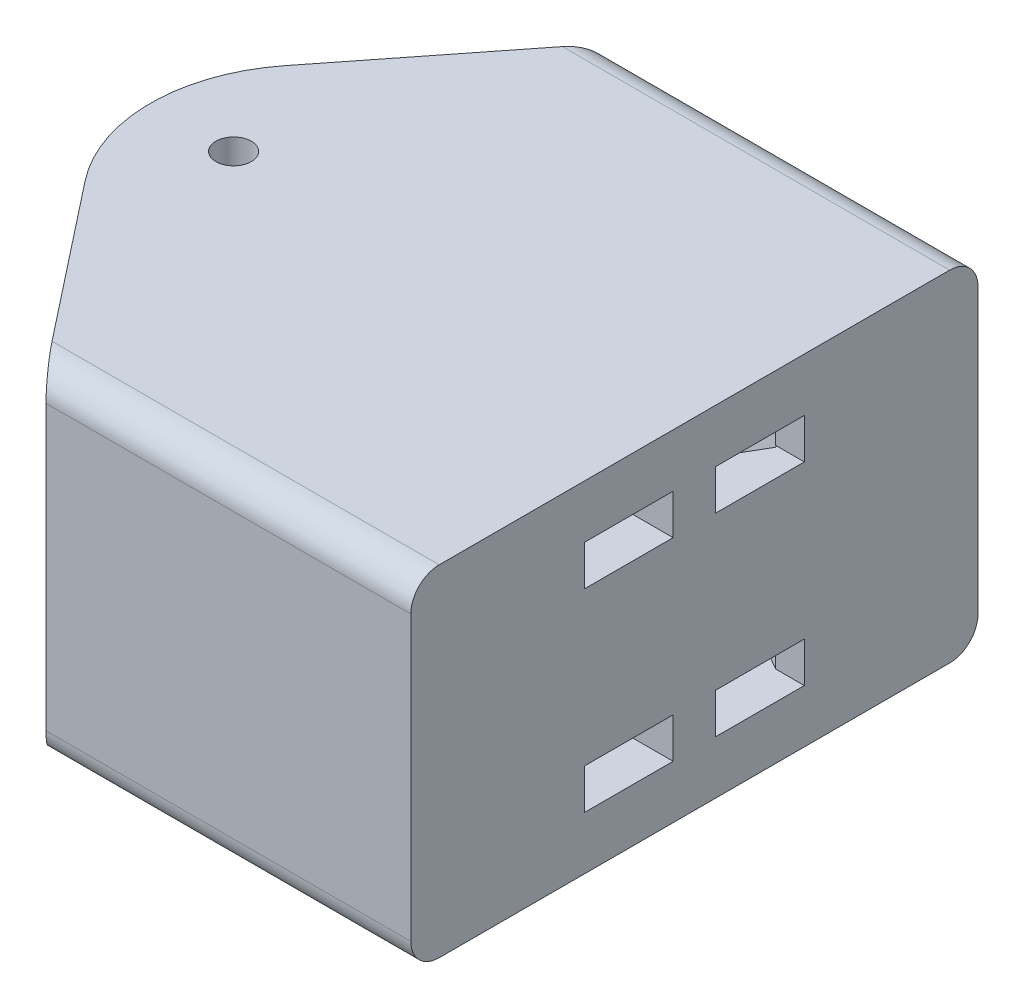
from build123d import *

# Parameters (mm, degrees)
BOSS_EXTRUDE2_DEPTH = 3.3
SKETCH5_R           = 0.5
SKETCH5_W           = 10.292404403
SKETCH5_H           = 16
BOSS_EXTRUDE3_DEPTH = 1.5
SKETCH7_W           = 2.4988973
SKETCH7_H           = 1.136262802
CUT_EXTRUDE1_DEPTH  = 18.9628088
FILLET1_R           = 0.8
FILLET2_R           = 0.8


with BuildPart() as part:
    # Sketch6 → Boss-Extrude2 (new, symmetric)
    with BuildSketch(Plane(origin=(0, 0, 0), x_dir=(1, 0, 0), z_dir=(0, 1, 0))):
        Polygon((13, 8), (13, -8), (4.706393415, -8), (2.707595597, -8), (2.707595597, -7.141772619), (5.22657427, -7.141772619), (12.244932652, -3.06812199), (10.464109218, 0), (12.244932652, 3.06812199), (5.438439019, 7.01880042), (2.707595597, 7.01880042), (2.707595597, 8), (4.706393415, 8), align=None)
    extrude(amount=BOSS_EXTRUDE2_DEPTH, both=True)

    # Sketch5 → Boss-Extrude3 (add)
    # profile 1 of 2: a face of its own
    with BuildSketch(Plane(origin=(0, 3.3, 0), x_dir=(1, 0, 0), z_dir=(0, 1, 0))):
        with BuildLine():
            Line((2.707595597, -8), (2.707595597, 8))
            Line((2.707595597, 8), (-1.374953719, 2.814641346))
            ThreePointArc((-1.374953719, 2.814641346), (-2.35, 0), (-1.374953719, -2.814641346))
            Line((-1.374953719, -2.814641346), (2.707595597, -8))
        make_face()
        with Locations(Location((0, 0, 0), (0, 0, 270))):
            Circle(SKETCH5_R, mode=Mode.SUBTRACT)
    # profile 2 of 2: a face of its own
    with BuildSketch(Plane(origin=(0, 3.3, 0), x_dir=(1, 0, 0), z_dir=(0, 1, 0))):
        with Locations((7.853797799, 0)):
            Rectangle(SKETCH5_W, SKETCH5_H)
    boss_extrude3 = extrude(amount=BOSS_EXTRUDE3_DEPTH)

    # Mirror1: Boss-Extrude3 across plane
    add(boss_extrude3.mirror(Plane.ZX))

    # Sketch7 → Cut-Extrude1 (cut, through all)
    with BuildSketch(Plane(origin=(13, 0, 0), x_dir=(0, 0, -1), z_dir=(1, 0, 0))):
        with Locations((-1.85055135, 2.731868599)):
            Rectangle(SKETCH7_W, SKETCH7_H)
        with Locations((1.85055135, 2.731868599)):
            Rectangle(SKETCH7_W, SKETCH7_H)
        with Locations((-1.85055135, -2.731868599)):
            Rectangle(SKETCH7_W, SKETCH7_H)
        with Locations((1.85055135, -2.731868599)):
            Rectangle(SKETCH7_W, SKETCH7_H)
    extrude(amount=-CUT_EXTRUDE1_DEPTH, mode=Mode.SUBTRACT)

    # Fillet1
    # the kernel refuses this fillet: 0.8 mm, written as the material it adds along each edge
    with BuildSketch(Plane(origin=(2.707595597, -3.3, 8), x_dir=(0, 1, 0), z_dir=(0, 0, -1))) as fillet1_piece_1_section:
        with BuildLine():
            CenterArc((FILLET1_R, -FILLET1_R), FILLET1_R, 90, 90)
            Line((0, -FILLET1_R), (0, 0))
            Line((0, 0), (FILLET1_R, 0))
        make_face()
    fillet1_piece_1 = extrude(amount=0.858227381, mode=Mode.PRIVATE)
    fillet1_piece_1 = split(fillet1_piece_1, bisect_by=Plane(origin=(2.414269103, -3.083958399, 7.627437917), z_dir=(0.785704114090993, 0, -0.6186024936099819)), keep=Keep.TOP, mode=Mode.PRIVATE)
    add(fillet1_piece_1)
    with BuildSketch(Plane(origin=(2.707595597, -3.3, -7.01880042), x_dir=(0, 1, 0), z_dir=(0, 0, -1))) as fillet1_piece_2_section:
        with BuildLine():
            CenterArc((FILLET1_R, -FILLET1_R), FILLET1_R, 90, 90)
            Line((0, -FILLET1_R), (0, 0))
            Line((0, 0), (FILLET1_R, 0))
        make_face()
    fillet1_piece_2 = extrude(amount=0.98119958, mode=Mode.PRIVATE)
    fillet1_piece_2 = split(fillet1_piece_2, bisect_by=Plane(origin=(2.378311496, -3.089381115, -7.581767168), z_dir=(0.7857041140909933, 0, 0.6186024936099818)), keep=Keep.TOP, mode=Mode.PRIVATE)
    add(fillet1_piece_2)
    with BuildSketch(Plane(origin=(2.707595597, 3.3, -7.01880042), x_dir=(0, -1, 0), z_dir=(0, 0, -1))) as fillet1_piece_3_section:
        with BuildLine():
            CenterArc((FILLET1_R, FILLET1_R), FILLET1_R, 180, 90)
            Line((0, FILLET1_R), (0, 0))
            Line((0, 0), (FILLET1_R, 0))
        make_face()
    fillet1_piece_3 = extrude(amount=0.98119958, mode=Mode.PRIVATE)
    fillet1_piece_3 = split(fillet1_piece_3, bisect_by=Plane(origin=(2.378311496, 3.089381115, -7.581767168), z_dir=(0.7857041140909933, 0, 0.6186024936099818)), keep=Keep.TOP, mode=Mode.PRIVATE)
    add(fillet1_piece_3)
    with BuildSketch(Plane(origin=(2.707595597, 3.3, 8), x_dir=(0, -1, 0), z_dir=(0, 0, -1))) as fillet1_piece_4_section:
        with BuildLine():
            CenterArc((FILLET1_R, FILLET1_R), FILLET1_R, 180, 90)
            Line((0, FILLET1_R), (0, 0))
            Line((0, 0), (FILLET1_R, 0))
        make_face()
    fillet1_piece_4 = extrude(amount=0.858227381, mode=Mode.PRIVATE)
    fillet1_piece_4 = split(fillet1_piece_4, bisect_by=Plane(origin=(2.414269103, 3.083958399, 7.627437917), z_dir=(0.785704114090993, 0, -0.6186024936099819)), keep=Keep.TOP, mode=Mode.PRIVATE)
    add(fillet1_piece_4)

    # Fillet2
    fillet2_edges = [part.edges().sort_by_distance(p)[0] for p in [
        (7.853797799, 4.8, 8),
        (7.853797799, 4.8, -8),
        (7.853797799, -4.8, -8),
        (7.853797799, -4.8, 8),
    ]]
    fillet(fillet2_edges, radius=FILLET2_R)


solid = part.part
